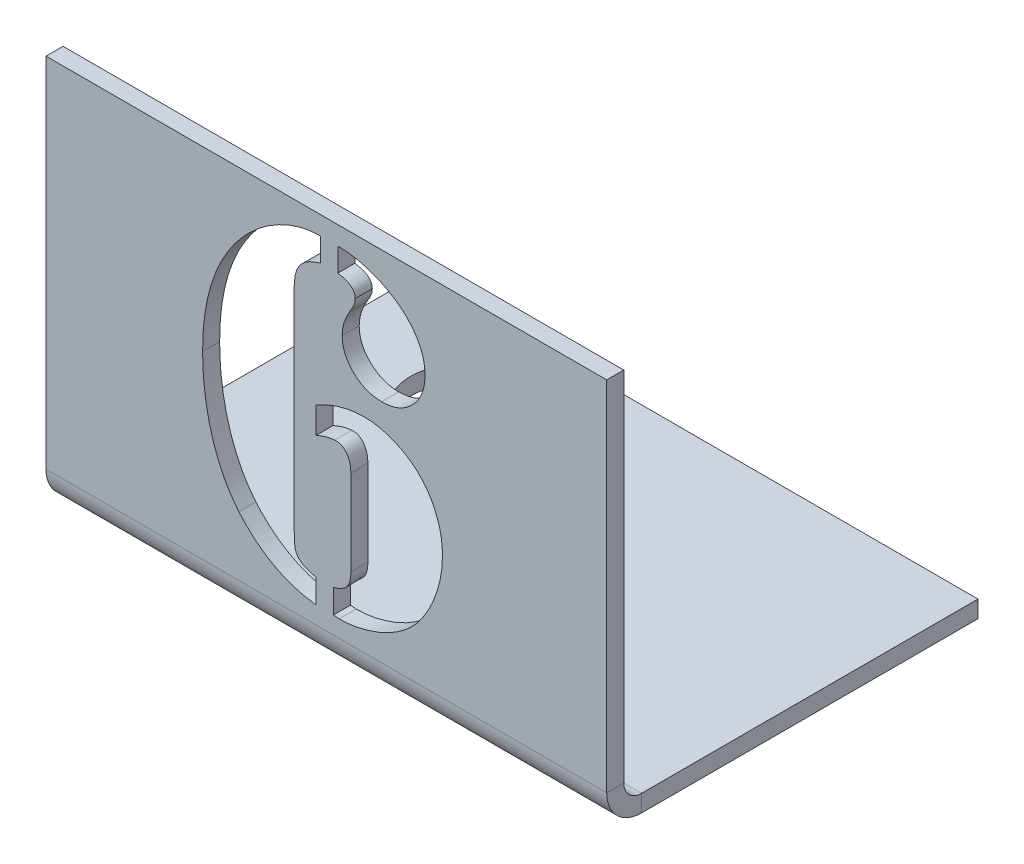
from build123d import *

# Parameters (mm, degrees)
SKETCH1_W            = 50
SKETCH1_H            = 30
BASE_FLANGE1_DEPTH   = 1.51892
EDGE_FLANGE1_DEPTH   = 50
M8_CLEARANCE_HOLE1_D = 9
CUT_EXTRUDE1_DEPTH   = 55.277389816


# Sheet-metal steps are written as plain solids
with BuildPart() as part:
    # Sketch1 → Base-Flange1 (new body)
    with BuildSketch(Plane(origin=(0, 0, 0), x_dir=(1, 0, 0), z_dir=(0, 1, 0))):
        with Locations((0, 15)):
            Rectangle(SKETCH1_W, SKETCH1_H)
    extrude(amount=BASE_FLANGE1_DEPTH)

    # Edge-Flange1 section (across the edge) → Edge-Flange1 (add)
    with BuildSketch(Plane(origin=(-25, 1.51892, 1.5875), x_dir=(0, 0, -1), z_dir=(1, 0, 0))):
        with BuildLine():
            Line((-1.51892, 1.5875), (-1.51892, 33.48108))
            Line((-1.51892, 33.48108), (0, 33.48108))
            Line((0, 33.48108), (0, 1.5875))
            ThreePointArc((0, 1.5875), (0.464967985, 0.464967985), (1.5875, 0))
            Line((1.5875, 0), (1.5875, -1.51892))
            ThreePointArc((1.5875, -1.51892), (-0.609070647, -0.609070647), (-1.51892, 1.5875))
        make_face()
    extrude(amount=EDGE_FLANGE1_DEPTH)

    # M8 Clearance Hole1 (through all)
    with Locations(Plane(origin=(0, 1.51892, 0), x_dir=(1, 0, 0), z_dir=(0, 1, 0))):
        with Locations((-13, 21.89358)):
            Hole(M8_CLEARANCE_HOLE1_D / 2)

    # Sketch11 → Cut-Extrude1 (cut, through all)
    with BuildSketch(Plane.XY.offset(3.10642)):
        with BuildLine():
            Line((-0.536205236, 33.346354167), (-0.536205236, 31.25))
            add(Edge.make_bspline(
                [(-0.536205236, 31.25), (-0.732304351, 31.187728797), (-1.102067969, 31.070310494), (-1.604733174, 30.833115296), (-2.017508244, 30.547560299), (-2.348134384, 30.212441135), (-2.583648684, 29.809655364), (-2.755765248, 29.34801065), (-2.848017529, 28.810847769), (-2.862096707, 28.430876813), (-2.869538569, 28.230034722)],
                knots=[0, 0, 0, 0, 1.177836724, 2.220923683, 3.170508287, 4.04032801, 4.893978525, 5.822851288, 6.849219673, 8, 8, 8, 8], degree=3))
            Line((-2.869538569, 28.230034722), (-2.869538569, 9.490451389))
            add(Edge.make_bspline(
                [(-2.869538569, 9.490451389), (-2.867825411, 9.340569917), (-2.864676289, 9.065058229), (-2.856032947, 8.687922323), (-2.830901599, 8.38587715), (-2.796864936, 8.086599995), (-2.694246063, 7.767569857), (-2.532312838, 7.572117956), (-2.450267736, 7.473090278)],
                knots=[0, 0, 0, 0, 1.276365713, 2.34621177, 3.211297358, 3.855222149, 4.913326661, 6, 6, 6, 6], degree=3))
            add(Edge.make_bspline(
                [(-2.450267736, 7.473090278), (-2.372143104, 7.400138444), (-2.201489167, 7.240783867), (-1.849576421, 7.073415225), (-1.421039194, 6.915571991), (-1.09843104, 6.839489909), (-0.925094125, 6.798611111)],
                knots=[0, 0, 0, 0, 0.755126351, 1.649483421, 2.737070691, 4, 4, 4, 4], degree=3))
            Line((-0.925094125, 6.798611111), (-0.925094125, 4.659722222))
            add(Edge.make_bspline(
                [(-0.925094125, 4.659722222), (-1.254477967, 4.70572391), (-1.909616136, 4.797220389), (-2.867595341, 5.052416526), (-3.795873677, 5.392904571), (-4.688251224, 5.825940849), (-5.545074878, 6.341217745), (-6.343237475, 6.957264962), (-7.115245839, 7.634651596), (-7.571961107, 8.152383248), (-7.803566347, 8.414930556)],
                knots=[0, 0, 0, 0, 0.993273036, 1.975601091, 2.956248835, 3.944528193, 4.936047062, 5.938575079, 6.95462918, 8, 8, 8, 8], degree=3))
            add(Edge.make_bspline(
                [(-7.803566347, 8.414930556), (-8.055058907, 8.733178871), (-8.569676873, 9.384396149), (-9.198622321, 10.4993388), (-9.754805445, 11.72710012), (-10.215414522, 13.070861325), (-10.585289747, 14.50493195), (-10.841878152, 16.009183271), (-11.005265617, 17.572495268), (-11.025763903, 18.635000654), (-11.036205236, 19.176215278)],
                knots=[0, 0, 0, 0, 0.848908429, 1.737083309, 2.673598995, 3.670958022, 4.709700774, 5.773871062, 6.866063596, 8, 8, 8, 8], degree=3))
            add(Edge.make_bspline(
                [(-11.036205236, 19.176215278), (-11.026382584, 19.748044697), (-11.00719909, 20.864819137), (-10.803957186, 22.492136825), (-10.496270468, 24.032412225), (-10.041921928, 25.477668954), (-9.472269882, 26.8365081), (-8.767858972, 28.100340729), (-7.942830537, 29.28019574), (-7.291562466, 29.981060383), (-6.96502468, 30.332465278)],
                knots=[0, 0, 0, 0, 1.125083173, 2.197270879, 3.223201206, 4.213147336, 5.174373174, 6.118528402, 7.056653326, 8, 8, 8, 8], degree=3))
            add(Edge.make_bspline(
                [(-6.96502468, 30.332465278), (-6.725570757, 30.561318773), (-6.251387297, 31.014510524), (-5.487846636, 31.614362799), (-4.688422822, 32.12911505), (-3.86871675, 32.565937556), (-3.032292491, 32.912249239), (-2.196660266, 33.165240479), (-1.364102414, 33.317178289), (-0.810236123, 33.33669706), (-0.536205236, 33.346354167)],
                knots=[0, 0, 0, 0, 1.091574889, 2.161613191, 3.195169959, 4.222755612, 5.219792993, 6.174728054, 7.096928445, 8, 8, 8, 8], degree=3))
        make_face()
        with BuildLine():
            Line((1.01935032, 31.25), (1.01935032, 33.346354167))
            add(Edge.make_bspline(
                [(1.01935032, 33.346354167), (1.35638191, 33.334410674), (2.037279483, 33.310281496), (3.058991771, 33.118596613), (4.086623836, 32.809565238), (4.751119346, 32.513303808), (5.090530875, 32.361979167)],
                knots=[0, 0, 0, 0, 0.957329974, 1.934072875, 2.94476415, 4, 4, 4, 4], degree=3))
            add(Edge.make_bspline(
                [(5.090530875, 32.361979167), (5.37000628, 32.21892083), (5.91492361, 31.939987638), (6.646983826, 31.416730734), (7.286526768, 30.837752524), (7.82321414, 30.197129791), (8.256096639, 29.513712062), (8.573154519, 28.794283899), (8.762120848, 28.043236683), (8.785435523, 27.532288153), (8.797128098, 27.276041667)],
                knots=[0, 0, 0, 0, 1.133386976, 2.209862454, 3.240979251, 4.243853893, 5.220771738, 6.155072333, 7.074747837, 8, 8, 8, 8], degree=3))
            add(Edge.make_bspline(
                [(8.797128098, 27.276041667), (8.785638647, 27.003188082), (8.763244087, 26.471357992), (8.548147846, 25.708802292), (8.197928052, 25.014727339), (7.708022484, 24.411080511), (7.125276809, 23.904679385), (6.45424304, 23.538240792), (5.711854464, 23.317351012), (5.193341007, 23.291224684), (4.926468375, 23.277777778)],
                knots=[0, 0, 0, 0, 1.052335015, 2.051149251, 3.034759759, 4.037094461, 5.036307284, 5.99952726, 6.970380773, 8, 8, 8, 8], degree=3))
            add(Edge.make_bspline(
                [(4.926468375, 23.277777778), (4.690324716, 23.288887346), (4.228795332, 23.310600367), (3.563454835, 23.498531551), (2.960039675, 23.816514126), (2.421279895, 24.239764216), (1.97438813, 24.750484649), (1.643916355, 25.323376327), (1.446805269, 25.950992233), (1.421287465, 26.385472211), (1.408239209, 26.607638889)],
                knots=[0, 0, 0, 0, 1.052177608, 2.056421433, 3.054792914, 4.078048738, 5.096504648, 6.06384139, 7.009966053, 8, 8, 8, 8], degree=3))
            add(Edge.make_bspline(
                [(1.408239209, 26.607638889), (1.417230139, 26.788519635), (1.435506133, 27.156198562), (1.561436361, 27.705294624), (1.770484915, 28.252331108), (1.964711734, 28.598881271), (2.064489209, 28.776909722)],
                knots=[0, 0, 0, 0, 0.946230724, 1.923416974, 2.933225545, 4, 4, 4, 4], degree=3))
            add(Edge.make_bspline(
                [(2.064489209, 28.776909722), (2.152068669, 28.919314407), (2.30090363, 29.161320873), (2.46871514, 29.496928508), (2.563747337, 29.786024985), (2.571152453, 29.971229688), (2.574905875, 30.065104167)],
                knots=[0, 0, 0, 0, 1.426676034, 2.424532782, 3.201444875, 4, 4, 4, 4], degree=3))
            add(Edge.make_bspline(
                [(2.574905875, 30.065104167), (2.57089384, 30.142783896), (2.563194833, 30.291849587), (2.484310793, 30.502479258), (2.358514484, 30.688139304), (2.186764713, 30.855164059), (1.959059048, 30.986654466), (1.690482224, 31.102662213), (1.371607963, 31.192747437), (1.141356267, 31.230170329), (1.01935032, 31.25)],
                knots=[0, 0, 0, 0, 0.864688311, 1.659317839, 2.475251474, 3.355494564, 4.310252246, 5.394837407, 6.619574429, 8, 8, 8, 8], degree=3))
        make_face()
        with BuildLine():
            Line((-0.925094125, 17.748263889), (-0.925094125, 20.105902778))
            add(Edge.make_bspline(
                [(-0.925094125, 20.105902778), (-0.562172057, 20.292252137), (0.141848053, 20.653744887), (1.229104149, 21.047376471), (2.303547114, 21.282260708), (3.015380537, 21.316516402), (3.364836431, 21.333333333)],
                knots=[0, 0, 0, 0, 1.085282539, 2.105302489, 3.069848097, 4, 4, 4, 4], degree=3))
            add(Edge.make_bspline(
                [(3.364836431, 21.333333333), (3.575767493, 21.32728003), (3.999566405, 21.315117842), (4.635355291, 21.222102337), (5.267804942, 21.05982284), (5.896889917, 20.850033552), (6.507494748, 20.584589713), (7.083966485, 20.267929702), (7.626171736, 19.909707688), (7.95313475, 19.631336083), (8.116572542, 19.4921875)],
                knots=[0, 0, 0, 0, 0.972589152, 1.954108701, 2.955474046, 3.980479148, 5.009562198, 6.021200449, 7.010864794, 8, 8, 8, 8], degree=3))
            add(Edge.make_bspline(
                [(8.116572542, 19.4921875), (8.286591287, 19.323607302), (8.627940088, 18.985146688), (9.071361238, 18.408935486), (9.454453028, 17.780658412), (9.776451155, 17.106691604), (10.028216962, 16.397029145), (10.222125832, 15.662485068), (10.331364306, 14.901746379), (10.345542817, 14.386322918), (10.352683653, 14.126736111)],
                knots=[0, 0, 0, 0, 0.960654025, 1.928717332, 2.91079185, 3.911286876, 4.922404946, 5.930508659, 6.95772566, 8, 8, 8, 8], degree=3))
            add(Edge.make_bspline(
                [(10.352683653, 14.126736111), (10.342759002, 13.779655432), (10.322905808, 13.085357977), (10.142569288, 12.051162813), (9.862554364, 11.02542886), (9.476763198, 10.022432767), (9.004721612, 9.072584195), (8.453195982, 8.205333864), (7.831858662, 7.432367139), (7.350754184, 6.995429904), (7.113968375, 6.780381944)],
                knots=[0, 0, 0, 0, 1.007304958, 2.015004901, 3.039646456, 4.091698815, 5.130844098, 6.114845671, 7.072181175, 8, 8, 8, 8], degree=3))
            add(Edge.make_bspline(
                [(7.113968375, 6.780381944), (6.90801948, 6.620680668), (6.492761858, 6.298672764), (5.810841905, 5.877851847), (5.075224903, 5.510264937), (4.300519423, 5.189578578), (3.502536323, 4.938418331), (2.707743298, 4.746095899), (1.917876024, 4.633000789), (1.394402127, 4.618367855), (1.134801709, 4.611111111)],
                knots=[0, 0, 0, 0, 0.965288144, 1.946323901, 2.963451572, 4.010279453, 5.050032815, 6.060491454, 7.038161726, 8, 8, 8, 8], degree=3))
            Line((1.134801709, 4.611111111), (0.630461431, 4.659722222))
            Line((0.630461431, 4.659722222), (0.630461431, 6.798611111))
            add(Edge.make_bspline(
                [(0.630461431, 6.798611111), (0.761629372, 6.832809064), (1.009712074, 6.897488897), (1.339469946, 7.055085592), (1.619820156, 7.225387633), (1.836416232, 7.442876654), (2.00089705, 7.701001552), (2.10558164, 8.011490131), (2.173038554, 8.367464004), (2.181530549, 8.621171288), (2.186016987, 8.755208333)],
                knots=[0, 0, 0, 0, 1.174511043, 2.221395497, 3.163228448, 4.009149245, 4.86326273, 5.798169132, 6.836742493, 8, 8, 8, 8], degree=3))
            Line((2.186016987, 8.755208333), (2.186016987, 16.387152778))
            add(Edge.make_bspline(
                [(2.186016987, 16.387152778), (2.181817499, 16.525217563), (2.17384572, 16.787302382), (2.101574404, 17.159744372), (1.974463868, 17.485857622), (1.796962527, 17.761186859), (1.584899926, 17.984342452), (1.334196604, 18.144788488), (1.046391899, 18.224495567), (0.847588512, 18.222991473), (0.74591282, 18.222222222)],
                knots=[0, 0, 0, 0, 1.252532866, 2.377650834, 3.425917608, 4.410309965, 5.333554112, 6.20090564, 7.079874001, 8, 8, 8, 8], degree=3))
            add(Edge.make_bspline(
                [(0.74591282, 18.222222222), (0.630014522, 18.213015719), (0.379223237, 18.193093849), (-0.016789147, 18.093798205), (-0.460026427, 17.948951586), (-0.764057901, 17.817754823), (-0.925094125, 17.748263889)],
                knots=[0, 0, 0, 0, 0.797685093, 1.726103611, 2.795586252, 4, 4, 4, 4], degree=3))
        make_face()
    extrude(amount=-CUT_EXTRUDE1_DEPTH, mode=Mode.SUBTRACT)


solid = part.part
